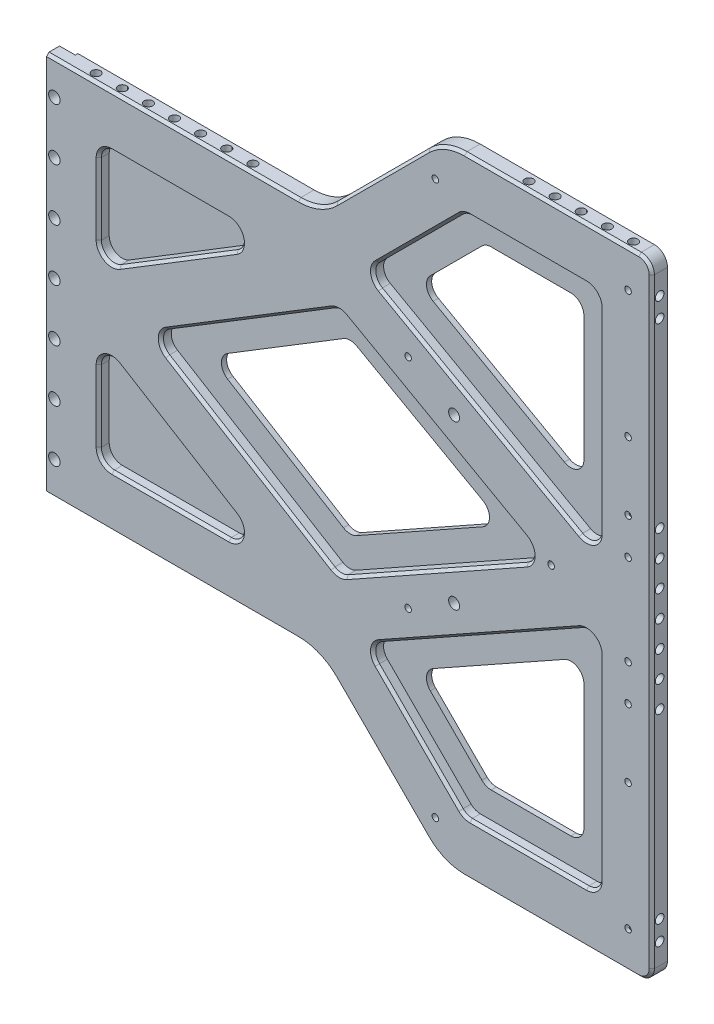
from build123d import *

# Parameters (mm, degrees)
EXTRUDE_1_DEPTH             = 1
EXTRUDE_2_DEPTH             = 5
FILLET_1_R                  = 20
CUT_EXTRUDE_1_DEPTH         = 4
FILLET_2_R                  = 5
CUT_EXTRUDE_2_DEPTH         = 5
FILLET_3_R                  = 5
FILLET_4_R                  = 5
CHAMFER_1_SIZE              = 1
CHAMFER_2_SIZE              = 1
CUT_EXTRUDE_3_DEPTH         = 266.872881163
CUT_EXTRUDE_3_DEPTH_BACK    = 266.872881163
SKETCH_5_R                  = 2.2
HOLE_WIZARD_M4_1_AT_2_COUNT = 2
HOLE_WIZARD_M4_1_AT_2_PITCH = 10
HOLE_WIZARD_M4_1_AT_3_COUNT = 2
HOLE_WIZARD_M4_1_AT_3_PITCH = 20
HOLE_WIZARD_M4_1_AT_4_COUNT = 2
HOLE_WIZARD_M4_1_AT_4_PITCH = 30
HOLE_WIZARD_M4_1_AT_5_COUNT = 2
HOLE_WIZARD_M4_1_AT_5_PITCH = 40
HOLE_WIZARD_M4_1_AT_6_COUNT = 2
HOLE_WIZARD_M4_1_AT_6_PITCH = 50
HOLE_WIZARD_M4_1_AT_7_COUNT = 2
HOLE_WIZARD_M4_1_AT_7_PITCH = 60
HOLE_WIZARD_M4_2_AT_2_COUNT = 2
HOLE_WIZARD_M4_2_AT_2_PITCH = 10
HOLE_WIZARD_M4_2_AT_3_COUNT = 2
HOLE_WIZARD_M4_2_AT_3_PITCH = 20
HOLE_WIZARD_M4_2_AT_4_COUNT = 2
HOLE_WIZARD_M4_2_AT_4_PITCH = 30
HOLE_WIZARD_M4_2_AT_5_COUNT = 2
HOLE_WIZARD_M4_2_AT_5_PITCH = 40
HOLE_WIZARD_M4_3_AT_2_COUNT = 2
HOLE_WIZARD_M4_3_AT_2_PITCH = 7.5
HOLE_WIZARD_M5_1_D          = 4.2
HOLE_WIZARD_M5_1_DEPTH      = 12.4
HOLE_WIZARD_M5_1_TIP        = 1.2618073
HOLE_WIZARD_M4_4_D          = 3.3
HOLE_WIZARD_M4_4_DEPTH      = 10.1
HOLE_WIZARD_M4_4_TIP        = 0.991420021
HOLE_WIZARD_M3_1_AT_2_COUNT = 2
HOLE_WIZARD_M3_1_AT_2_PITCH = 64.972623466
HOLE_WIZARD_M3_1_AT_3_COUNT = 2
HOLE_WIZARD_M3_1_AT_3_PITCH = 68.85714545
HOLE_WIZARD_M3_1_AT_4_COUNT = 2
HOLE_WIZARD_M3_1_AT_4_PITCH = 84.831082157
HOLE_WIZARD_M3_1_AT_5_COUNT = 2
HOLE_WIZARD_M3_1_AT_5_PITCH = 87.639356456
HOLE_WIZARD_M3_1_AT_6_COUNT = 2
HOLE_WIZARD_M3_1_AT_6_PITCH = 105.831054044
HOLE_WIZARD_M3_1_AT_7_COUNT = 2
HOLE_WIZARD_M3_1_AT_7_PITCH = 85.616918889


with BuildPart() as part:
    # 草图1 → 凸台-拉伸1 (new body)
    with BuildSketch(Plane.XY):
        Polygon((11.5, 73), (110.175860782, 73), (157.175860782, 120), (237.175860782, 120), (237.175860782, -120), (157.175860782, -120), (110.175860782, -73), (11.5, -73), align=None)
    extrude(amount=-EXTRUDE_1_DEPTH)

    # 草图2 → 凸台-拉伸2 (add)
    with BuildSketch(Plane.XY):
        Polygon((11.5, 73), (5.5, 73), (5.5, -73), (11.5, -73), (110.175860782, -73), (157.175860782, -120), (237.175860782, -120), (237.175860782, 120), (157.175860782, 120), (110.175860782, 73), align=None)
    extrude(amount=EXTRUDE_2_DEPTH)

    # 圆角1
    fillet_1_edges = [part.edges().sort_by_distance(p)[0] for p in [
        (157.175860782, 120, 2),
        (157.175860782, -120, 2),
        (110.175860782, -73, 2),
        (110.175860782, 73, 2),
    ]]
    fillet(fillet_1_edges, radius=FILLET_1_R)

    # 草图3 → 切除-拉伸1 (cut)
    with BuildSketch(Plane.XY.offset(5)):
        with BuildLine():
            Line((127.111323554, 61.952213992), (217.175860782, 11.464061769))
            Line((217.175860782, 11.464061769), (217.175860782, 100))
            Line((217.175860782, 100), (165.46013203, 100))
            Line((165.46013203, 100), (130.175860782, 64.715728753))
            ThreePointArc((130.175860782, 64.715728753), (128.679252709, 63.294426421), (127.111323554, 61.952213992))
        make_face()
        with BuildLine():
            Line((217.175860782, -100), (217.175860782, -11.464061769))
            Line((217.175860782, -11.464061769), (127.111323554, -61.952213992))
            ThreePointArc((127.111323554, -61.952213992), (128.679252709, -63.294426421), (130.175860782, -64.715728752))
            Line((130.175860782, -64.715728752), (165.46013203, -100))
            Line((165.46013203, -100), (217.175860782, -100))
        make_face()
        Polygon((25.5, 11.719831794), (93.041428657, 53), (25.5, 53), align=None)
        Polygon((25.5, -53), (93.041428657, -53), (25.5, -11.719831794), align=None)
        Polygon((117.41720526, -44.458394956), (196.725411073, 0), (117.41720526, 44.458394956), (44.675653042, 0), align=None)
    extrude(amount=-CUT_EXTRUDE_1_DEPTH, mode=Mode.SUBTRACT)

    # 圆角2
    fillet_2_edges = [part.edges().sort_by_distance(p)[0] for p in [
        (165.46013203, -100, 3),
        (217.175860782, -100, 3),
        (217.175860782, -11.464061769, 3),
        (127.111323554, -61.952213992, 3),
        (217.175860782, 11.464061769, 3),
        (165.46013203, 100, 3),
        (127.111323554, 61.952213992, 3),
        (117.41720526, 44.458394956, 3),
        (44.675653042, 0, 3),
        (117.41720526, -44.458394956, 3),
        (196.725411073, 0, 3),
        (25.5, -53, 3),
        (93.041428657, -53, 3),
        (25.5, -11.719831794, 3),
        (25.5, 53, 3),
        (25.5, 11.719831794, 3),
        (93.041428657, 53, 3),
        (217.175860782, 100, 3),
    ]]
    fillet(fillet_2_edges, radius=FILLET_2_R)

    # 草图4 → 切除-拉伸2 (cut)
    with BuildSketch(Plane.XY.offset(1)):
        Polygon((176.274961364, 0), (117.635483691, 32.871971212), (63.851306083, 0), (117.635483691, -32.871971212), align=None)
        Polygon((143.712370298, 64.110102645), (207.175860782, 28.533898438), (207.175860782, 90), (169.602267653, 90), align=None)
        Polygon((143.712370298, -64.110102644), (169.602267653, -90), (207.175860782, -90), (207.175860782, -28.533898438), align=None)
    extrude(amount=-CUT_EXTRUDE_2_DEPTH, mode=Mode.SUBTRACT)

    # 圆角3
    fillet_3_edges = [part.edges().sort_by_distance(p)[0] for p in [
        (63.851306083, 0, 0),
        (117.635483691, 32.871971212, 0),
        (176.274961364, 0, 0),
        (117.635483691, -32.871971212, 0),
        (207.175860782, 90, 0),
        (207.175860782, 28.533898438, 0),
        (169.602267653, 90, 0),
        (207.175860782, -90, 0),
        (169.602267653, -90, 0),
        (143.712370298, -64.110102644, 0),
        (207.175860782, -28.533898438, 0),
        (143.712370298, 64.110102645, 0),
    ]]
    fillet(fillet_3_edges, radius=FILLET_3_R)

    # 圆角4
    fillet_4_edges = [part.edges().sort_by_distance(p)[0] for p in [
        (237.175860782, 120, 2),
        (237.175860782, -120, 2),
    ]]
    fillet(fillet_4_edges, radius=FILLET_4_R)

    # 倒角1
    chamfer_1_edges = [part.edges().sort_by_distance(p)[0] for p in [
        (26.964466094, 51.535533906, 5),
        (25.5, 34.317831169, 5),
        (52.886372686, 53, 5),
        (28.054326845, 16.274620854, 5),
        (80.085819451, 49.354369933, 5),
        (55.493845813, 30.051558335, 5),
        (26.964466094, -51.535533906, 5),
        (25.5, -34.317831169, 5),
        (52.886372686, -53, 5),
        (28.054326845, -16.274620854, 5),
        (80.085819451, -49.354369933, 5),
        (55.493845813, -30.051558335, 5),
        (49.263479563, 0, 5),
        (83.287438892, 23.598864376, 5),
        (83.287438892, -23.598864376, 5),
        (117.432165413, 43.664296036, 5),
        (117.432165413, -43.664296036, 5),
        (154.458199356, 23.694047456, 5),
        (154.458199356, -23.694047456, 5),
        (191.500186218, 0, 5),
        (165.61778268, -99.619397663, 5),
        (147.984212406, -82.524080377, 5),
        (189.853530312, -100, 5),
        (130.555302658, -62.293068947, 5),
        (215.711394688, -98.535533906, 5),
        (171.397142773, -37.126580608, 5),
        (217.175860782, -57.499490052, 5),
        (214.703243811, -15.684778552, 5),
        (171.397142773, 37.126580608, 5),
        (214.703243811, 15.684778552, 5),
        (130.555302658, 62.293068948, 5),
        (217.175860782, 57.499490052, 5),
        (147.984212406, 82.524080377, 5),
        (215.711394688, 98.535533906, 5),
        (165.61778268, 99.619397663, 5),
        (189.853530312, 100, 5),
    ]]
    chamfer(chamfer_1_edges, length=CHAMFER_1_SIZE)

    # 倒角2
    chamfer_2_edges = [part.edges().sort_by_distance(p)[0] for p in [
        (53.695794768, 73, 5),
        (109.545258182, 74.52240935, 5),
        (133.675860782, 96.5, 5),
        (53.695794767, -73, 5),
        (157.806463382, 118.47759065, 5),
        (109.545258182, -74.52240935, 5),
        (198.817996406, 120, 5),
        (133.675860782, -96.5, 5),
        (235.711394688, 118.535533906, 5),
        (157.806463382, -118.47759065, 5),
        (237.175860782, 0, 5),
        (198.817996406, -120, 5),
        (235.711394688, -118.535533906, 5),
    ]]
    chamfer(chamfer_2_edges, length=CHAMFER_2_SIZE)

    # 草图5 → 切除-拉伸3 (cut, two sides: drawn at the far end of the back side and taken through both)
    with BuildSketch(Plane.XY.offset(5).offset(-CUT_EXTRUDE_3_DEPTH_BACK)):
        with Locations((8.5, 60)):
            Circle(SKETCH_5_R)
        with Locations((8.5, 40)):
            Circle(SKETCH_5_R)
        with Locations((8.5, 20)):
            Circle(SKETCH_5_R)
        with Locations((8.5, 0)):
            Circle(SKETCH_5_R)
        with Locations((8.5, -20)):
            Circle(SKETCH_5_R)
        with Locations((8.5, -40)):
            Circle(SKETCH_5_R)
        with Locations((8.5, -60)):
            Circle(SKETCH_5_R)
    extrude(amount=CUT_EXTRUDE_3_DEPTH + CUT_EXTRUDE_3_DEPTH_BACK, mode=Mode.SUBTRACT)

    # 草图8 → M4 螺纹孔1 (revolve, cut)
    with BuildSketch(Plane(origin=(81.5, -73, 2), x_dir=(0, 0, -1), z_dir=(1, 0, 0))):
        Polygon((0, 0), (0, 11.091420021), (1.65, 10.1), (1.65, 0), align=None)
    hole_wizard_m4_1 = revolve(axis=Axis((81.5, -79.35, 2), (0, 1, 0)), mode=Mode.SUBTRACT)

    # M4 螺纹孔1 at 2: M4 螺纹孔1 ×2
    with Locations(*[(-i * HOLE_WIZARD_M4_1_AT_2_PITCH, 0, 0) for i in range(1, HOLE_WIZARD_M4_1_AT_2_COUNT)]):
        add(hole_wizard_m4_1, mode=Mode.SUBTRACT)

    # M4 螺纹孔1 at 3: M4 螺纹孔1 ×2
    with Locations(*[(-i * HOLE_WIZARD_M4_1_AT_3_PITCH, 0, 0) for i in range(1, HOLE_WIZARD_M4_1_AT_3_COUNT)]):
        add(hole_wizard_m4_1, mode=Mode.SUBTRACT)

    # M4 螺纹孔1 at 4: M4 螺纹孔1 ×2
    with Locations(*[(-i * HOLE_WIZARD_M4_1_AT_4_PITCH, 0, 0) for i in range(1, HOLE_WIZARD_M4_1_AT_4_COUNT)]):
        add(hole_wizard_m4_1, mode=Mode.SUBTRACT)

    # M4 螺纹孔1 at 5: M4 螺纹孔1 ×2
    with Locations(*[(-i * HOLE_WIZARD_M4_1_AT_5_PITCH, 0, 0) for i in range(1, HOLE_WIZARD_M4_1_AT_5_COUNT)]):
        add(hole_wizard_m4_1, mode=Mode.SUBTRACT)

    # M4 螺纹孔1 at 6: M4 螺纹孔1 ×2
    with Locations(*[(-i * HOLE_WIZARD_M4_1_AT_6_PITCH, 0, 0) for i in range(1, HOLE_WIZARD_M4_1_AT_6_COUNT)]):
        add(hole_wizard_m4_1, mode=Mode.SUBTRACT)

    # M4 螺纹孔1 at 7: M4 螺纹孔1 ×2
    with Locations(*[(-i * HOLE_WIZARD_M4_1_AT_7_PITCH, 0, 0) for i in range(1, HOLE_WIZARD_M4_1_AT_7_COUNT)]):
        add(hole_wizard_m4_1, mode=Mode.SUBTRACT)

    # 镜向1: M4 螺纹孔1 across plane
    add(hole_wizard_m4_1.mirror(Plane.ZX), mode=Mode.SUBTRACT)

    # 镜向1 copy 1 sketch → 镜向1 copy 1 (revolve, cut)
    with BuildSketch(Plane(origin=(71.5, 73, 2), x_dir=(0, 0, -1), z_dir=(1, 0, 0))):
        Polygon((0, 0), (0, -11.091420021), (1.65, -10.1), (1.65, 0), align=None)
    revolve(axis=Axis((71.5, 79.35, 2), (0, 1, 0)), mode=Mode.SUBTRACT)

    # 镜向1 copy 2 sketch → 镜向1 copy 2 (revolve, cut)
    with BuildSketch(Plane(origin=(61.5, 73, 2), x_dir=(0, 0, -1), z_dir=(1, 0, 0))):
        Polygon((0, 0), (0, -11.091420021), (1.65, -10.1), (1.65, 0), align=None)
    revolve(axis=Axis((61.5, 79.35, 2), (0, 1, 0)), mode=Mode.SUBTRACT)

    # 镜向1 copy 3 sketch → 镜向1 copy 3 (revolve, cut)
    with BuildSketch(Plane(origin=(51.5, 73, 2), x_dir=(0, 0, -1), z_dir=(1, 0, 0))):
        Polygon((0, 0), (0, -11.091420021), (1.65, -10.1), (1.65, 0), align=None)
    revolve(axis=Axis((51.5, 79.35, 2), (0, 1, 0)), mode=Mode.SUBTRACT)

    # 镜向1 copy 4 sketch → 镜向1 copy 4 (revolve, cut)
    with BuildSketch(Plane(origin=(41.5, 73, 2), x_dir=(0, 0, -1), z_dir=(1, 0, 0))):
        Polygon((0, 0), (0, -11.091420021), (1.65, -10.1), (1.65, 0), align=None)
    revolve(axis=Axis((41.5, 79.35, 2), (0, 1, 0)), mode=Mode.SUBTRACT)

    # 镜向1 copy 5 sketch → 镜向1 copy 5 (revolve, cut)
    with BuildSketch(Plane(origin=(31.5, 73, 2), x_dir=(0, 0, -1), z_dir=(1, 0, 0))):
        Polygon((0, 0), (0, -11.091420021), (1.65, -10.1), (1.65, 0), align=None)
    revolve(axis=Axis((31.5, 79.35, 2), (0, 1, 0)), mode=Mode.SUBTRACT)

    # 镜向1 copy 6 sketch → 镜向1 copy 6 (revolve, cut)
    with BuildSketch(Plane(origin=(21.5, 73, 2), x_dir=(0, 0, -1), z_dir=(1, 0, 0))):
        Polygon((0, 0), (0, -11.091420021), (1.65, -10.1), (1.65, 0), align=None)
    revolve(axis=Axis((21.5, 79.35, 2), (0, 1, 0)), mode=Mode.SUBTRACT)

    # 草图11 → M4 螺纹孔2 (revolve, cut)
    with BuildSketch(Plane(origin=(227.175860782, -120, 2), x_dir=(0, 0, -1), z_dir=(1, 0, 0))):
        Polygon((0, 0), (0, 11.091420021), (1.65, 10.1), (1.65, 0), align=None)
    hole_wizard_m4_2 = revolve(axis=Axis((227.175860782, -126.35, 2), (0, 1, 0)), mode=Mode.SUBTRACT)

    # M4 螺纹孔2 at 2: M4 螺纹孔2 ×2
    with Locations(*[(-i * HOLE_WIZARD_M4_2_AT_2_PITCH, 0, 0) for i in range(1, HOLE_WIZARD_M4_2_AT_2_COUNT)]):
        add(hole_wizard_m4_2, mode=Mode.SUBTRACT)

    # M4 螺纹孔2 at 3: M4 螺纹孔2 ×2
    with Locations(*[(-i * HOLE_WIZARD_M4_2_AT_3_PITCH, 0, 0) for i in range(1, HOLE_WIZARD_M4_2_AT_3_COUNT)]):
        add(hole_wizard_m4_2, mode=Mode.SUBTRACT)

    # M4 螺纹孔2 at 4: M4 螺纹孔2 ×2
    with Locations(*[(-i * HOLE_WIZARD_M4_2_AT_4_PITCH, 0, 0) for i in range(1, HOLE_WIZARD_M4_2_AT_4_COUNT)]):
        add(hole_wizard_m4_2, mode=Mode.SUBTRACT)

    # M4 螺纹孔2 at 5: M4 螺纹孔2 ×2
    with Locations(*[(-i * HOLE_WIZARD_M4_2_AT_5_PITCH, 0, 0) for i in range(1, HOLE_WIZARD_M4_2_AT_5_COUNT)]):
        add(hole_wizard_m4_2, mode=Mode.SUBTRACT)

    # 镜向2: M4 螺纹孔2 across plane
    add(hole_wizard_m4_2.mirror(Plane.ZX), mode=Mode.SUBTRACT)

    # 镜向2 copy 1 sketch → 镜向2 copy 1 (revolve, cut)
    with BuildSketch(Plane(origin=(217.175860782, 120, 2), x_dir=(0, 0, -1), z_dir=(1, 0, 0))):
        Polygon((0, 0), (0, -11.091420021), (1.65, -10.1), (1.65, 0), align=None)
    revolve(axis=Axis((217.175860782, 126.35, 2), (0, 1, 0)), mode=Mode.SUBTRACT)

    # 镜向2 copy 2 sketch → 镜向2 copy 2 (revolve, cut)
    with BuildSketch(Plane(origin=(207.175860782, 120, 2), x_dir=(0, 0, -1), z_dir=(1, 0, 0))):
        Polygon((0, 0), (0, -11.091420021), (1.65, -10.1), (1.65, 0), align=None)
    revolve(axis=Axis((207.175860782, 126.35, 2), (0, 1, 0)), mode=Mode.SUBTRACT)

    # 镜向2 copy 3 sketch → 镜向2 copy 3 (revolve, cut)
    with BuildSketch(Plane(origin=(197.175860782, 120, 2), x_dir=(0, 0, -1), z_dir=(1, 0, 0))):
        Polygon((0, 0), (0, -11.091420021), (1.65, -10.1), (1.65, 0), align=None)
    revolve(axis=Axis((197.175860782, 126.35, 2), (0, 1, 0)), mode=Mode.SUBTRACT)

    # 镜向2 copy 4 sketch → 镜向2 copy 4 (revolve, cut)
    with BuildSketch(Plane(origin=(187.175860782, 120, 2), x_dir=(0, 0, -1), z_dir=(1, 0, 0))):
        Polygon((0, 0), (0, -11.091420021), (1.65, -10.1), (1.65, 0), align=None)
    revolve(axis=Axis((187.175860782, 126.35, 2), (0, 1, 0)), mode=Mode.SUBTRACT)

    # 草图14 → M4 螺纹孔3 (revolve, cut)
    with BuildSketch(Plane(origin=(237.175860782, -99.5, 2), x_dir=(0, 0, -1), z_dir=(0, 1, 0))):
        Polygon((0, 0), (0, 11.091420021), (1.65, 10.1), (1.65, 0), align=None)
    hole_wizard_m4_3 = revolve(axis=Axis((243.525860782, -99.5, 2), (-1, 0, 0)), mode=Mode.SUBTRACT)

    # M4 螺纹孔3 at 2: M4 螺纹孔3 ×2
    with Locations(*[(0, -i * HOLE_WIZARD_M4_3_AT_2_PITCH, 0) for i in range(1, HOLE_WIZARD_M4_3_AT_2_COUNT)]):
        add(hole_wizard_m4_3, mode=Mode.SUBTRACT)

    # 镜向3: M4 螺纹孔3 across plane
    add(hole_wizard_m4_3.mirror(Plane.ZX), mode=Mode.SUBTRACT)

    # 镜向3 copy 1 sketch → 镜向3 copy 1 (revolve, cut)
    with BuildSketch(Plane(origin=(237.175860782, 107, 2), x_dir=(0, 0, -1), z_dir=(0, -1, 0))):
        Polygon((0, 0), (0, -11.091420021), (1.65, -10.1), (1.65, 0), align=None)
    revolve(axis=Axis((243.525860782, 107, 2), (1, 0, 0)), mode=Mode.SUBTRACT)

    # M5 螺纹孔1
    with Locations(Plane.XY.offset(5)):
        with Locations((161.5, 31.210634294), (161.5, -31.210634294)):
            Hole(HOLE_WIZARD_M5_1_D / 2, depth=HOLE_WIZARD_M5_1_DEPTH)
            with Locations((0, 0, -(HOLE_WIZARD_M5_1_DEPTH + HOLE_WIZARD_M5_1_TIP / 2))):  # 118° drill point
                Cone(0, HOLE_WIZARD_M5_1_D / 2, HOLE_WIZARD_M5_1_TIP, mode=Mode.SUBTRACT)

    # M4 螺纹孔4
    with Locations(Plane(origin=(237.175860782, 0, 0), x_dir=(0, 0, -1), z_dir=(1, 0, 0))):
        with Locations((-2, 30), (-2, 20), (-2, 10), (-2, 0), (-2, -10), (-2, -20), (-2, -30)):
            Hole(HOLE_WIZARD_M4_4_D / 2, depth=HOLE_WIZARD_M4_4_DEPTH)
            with Locations((0, 0, -(HOLE_WIZARD_M4_4_DEPTH + HOLE_WIZARD_M4_4_TIP / 2))):  # 118° drill point
                Cone(0, HOLE_WIZARD_M4_4_D / 2, HOLE_WIZARD_M4_4_TIP, mode=Mode.SUBTRACT)

    # 草图23 → M3 螺纹孔1 (revolve, cut)
    with BuildSketch(Plane(origin=(143.9, -41.700634294, 5), x_dir=(0, -1, 0), z_dir=(1, 0, 0))):
        Polygon((0, 0), (0, 8.251075774), (1.25, 7.5), (1.25, 0), align=None)
    hole_wizard_m3_1 = revolve(axis=Axis((143.9, -41.700634294, 11.35), (0, 0, -1)), mode=Mode.SUBTRACT)

    # M3 螺纹孔1 at 2: M3 螺纹孔1 ×2
    with Locations(*[Vector(0.1605291497198888, -0.98703109985968, 0) * (i * HOLE_WIZARD_M3_1_AT_2_PITCH) for i in range(1, HOLE_WIZARD_M3_1_AT_2_COUNT)]):
        add(hole_wizard_m3_1, mode=Mode.SUBTRACT)

    # M3 螺纹孔1 at 3: M3 螺纹孔1 ×2
    with Locations(*[Vector(0.7949792231794381, 0.606636657904068, 0) * (i * HOLE_WIZARD_M3_1_AT_3_PITCH) for i in range(1, HOLE_WIZARD_M3_1_AT_3_COUNT)]):
        add(hole_wizard_m3_1, mode=Mode.SUBTRACT)

    # M3 螺纹孔1 at 4: M3 螺纹孔1 ×2
    with Locations(*[Vector(0.9923249575407045, 0.12365750540035624, 0) * (i * HOLE_WIZARD_M3_1_AT_4_PITCH) for i in range(1, HOLE_WIZARD_M3_1_AT_4_COUNT)]):
        add(hole_wizard_m3_1, mode=Mode.SUBTRACT)

    # M3 螺纹孔1 at 5: M3 螺纹孔1 ×2
    with Locations(*[Vector(0.960527363552502, 0.2781855205917082, 0) * (i * HOLE_WIZARD_M3_1_AT_5_PITCH) for i in range(1, HOLE_WIZARD_M3_1_AT_5_COUNT)]):
        add(hole_wizard_m3_1, mode=Mode.SUBTRACT)

    # M3 螺纹孔1 at 6: M3 螺纹孔1 ×2
    with Locations(*[Vector(0.7954187054136518, -0.6060602965696321, 0) * (i * HOLE_WIZARD_M3_1_AT_6_PITCH) for i in range(1, HOLE_WIZARD_M3_1_AT_6_COUNT)]):
        add(hole_wizard_m3_1, mode=Mode.SUBTRACT)

    # M3 螺纹孔1 at 7: M3 螺纹孔1 ×2
    with Locations(*[Vector(0.9832168815768637, -0.18244057603029953, 0) * (i * HOLE_WIZARD_M3_1_AT_7_PITCH) for i in range(1, HOLE_WIZARD_M3_1_AT_7_COUNT)]):
        add(hole_wizard_m3_1, mode=Mode.SUBTRACT)

    # 镜向4: M3 螺纹孔1 across plane
    add(hole_wizard_m3_1.mirror(Plane.ZX), mode=Mode.SUBTRACT)

    # 镜向4 copy 1 sketch → 镜向4 copy 1 (revolve, cut)
    with BuildSketch(Plane(origin=(154.33, 105.830634294, 5), x_dir=(0, 1, 0), z_dir=(1, 0, 0))):
        Polygon((0, 0), (0, -8.251075774), (1.25, -7.5), (1.25, 0), align=None)
    revolve(axis=Axis((154.33, 105.830634294, 11.35), (0, 0, 1)), mode=Mode.SUBTRACT)

    # 镜向4 copy 2 sketch → 镜向4 copy 2 (revolve, cut)
    with BuildSketch(Plane(origin=(198.64, -0.070634294, 5), x_dir=(0, 1, 0), z_dir=(1, 0, 0))):
        Polygon((0, 0), (0, -8.251075774), (1.25, -7.5), (1.25, 0), align=None)
    revolve(axis=Axis((198.64, -0.070634294, 11.35), (0, 0, 1)), mode=Mode.SUBTRACT)

    # 镜向4 copy 3 sketch → 镜向4 copy 3 (revolve, cut)
    with BuildSketch(Plane(origin=(228.08, 31.210634294, 5), x_dir=(0, 1, 0), z_dir=(1, 0, 0))):
        Polygon((0, 0), (0, -8.251075774), (1.25, -7.5), (1.25, 0), align=None)
    revolve(axis=Axis((228.08, 31.210634294, 11.35), (0, 0, 1)), mode=Mode.SUBTRACT)

    # 镜向4 copy 4 sketch → 镜向4 copy 4 (revolve, cut)
    with BuildSketch(Plane(origin=(228.08, 17.320634294, 5), x_dir=(0, 1, 0), z_dir=(1, 0, 0))):
        Polygon((0, 0), (0, -8.251075774), (1.25, -7.5), (1.25, 0), align=None)
    revolve(axis=Axis((228.08, 17.320634294, 11.35), (0, 0, 1)), mode=Mode.SUBTRACT)

    # 镜向4 copy 5 sketch → 镜向4 copy 5 (revolve, cut)
    with BuildSketch(Plane(origin=(228.08, 105.840634294, 5), x_dir=(0, 1, 0), z_dir=(1, 0, 0))):
        Polygon((0, 0), (0, -8.251075774), (1.25, -7.5), (1.25, 0), align=None)
    revolve(axis=Axis((228.08, 105.840634294, 11.35), (0, 0, 1)), mode=Mode.SUBTRACT)

    # 镜向4 copy 6 sketch → 镜向4 copy 6 (revolve, cut)
    with BuildSketch(Plane(origin=(228.08, 57.320634294, 5), x_dir=(0, 1, 0), z_dir=(1, 0, 0))):
        Polygon((0, 0), (0, -8.251075774), (1.25, -7.5), (1.25, 0), align=None)
    revolve(axis=Axis((228.08, 57.320634294, 11.35), (0, 0, 1)), mode=Mode.SUBTRACT)


solid = part.part
